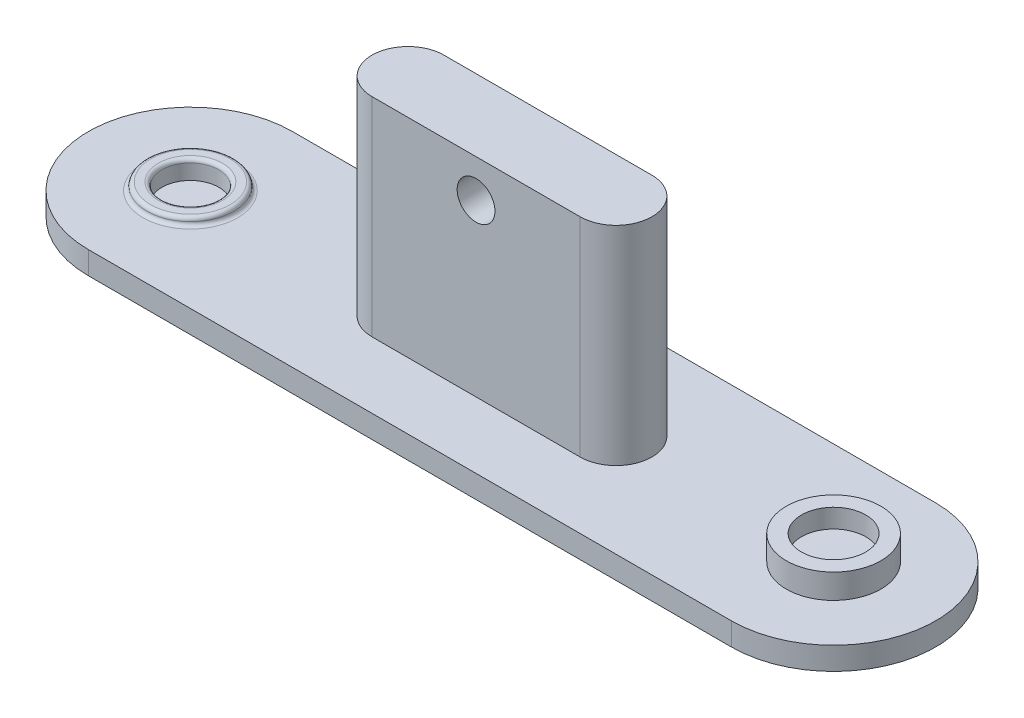
from build123d import *

# Parameters (mm, degrees)
BOSS_EXTRUDE1_DEPTH = 3
SKETCH7_R           = 5.75
BOSS_EXTRUDE5_DEPTH = 1
SKETCH2_R           = 3.75
CUT_EXTRUDE1_DEPTH  = 2.5
SKETCH3_R           = 6.25
BOSS_EXTRUDE3_DEPTH = 3.25
SKETCH4_R           = 4.25
CUT_EXTRUDE2_DEPTH  = 2.5
BOSS_EXTRUDE4_DEPTH = 27.5
SKETCH6_R           = 2.5
CUT_EXTRUDE3_DEPTH  = 67.327313378
FILLET1_R           = 0.5


with BuildPart() as part:
    # Sketch1 → Boss-Extrude1 (new body)
    with BuildSketch(Plane(origin=(0, 0, 0), x_dir=(1, 0, 0), z_dir=(0, 1, 0))):
        with BuildLine():
            Line((-42.5, -13.5), (42.5, -13.5))
            ThreePointArc((42.5, -13.5), (56, 0), (42.5, 13.5))
            Line((42.5, 13.5), (-42.5, 13.5))
            ThreePointArc((-42.5, 13.5), (-56, 0), (-42.5, -13.5))
        make_face()
    extrude(amount=BOSS_EXTRUDE1_DEPTH)

    # Sketch7 → Boss-Extrude5 (add)
    with BuildSketch(Plane(origin=(0, 3, 0), x_dir=(1, 0, 0), z_dir=(0, 1, 0))):
        with Locations(Location((-42.5, 0, 0), (0, 0, 270))):
            Circle(SKETCH7_R)
    extrude(amount=BOSS_EXTRUDE5_DEPTH)

    # Sketch2 → Cut-Extrude1 (cut)
    with BuildSketch(Plane(origin=(0, 4, 0), x_dir=(1, 0, 0), z_dir=(0, 1, 0))):
        with Locations(Location((-42.5, 0, 0), (0, 0, 270))):
            Circle(SKETCH2_R)
    extrude(amount=-CUT_EXTRUDE1_DEPTH, mode=Mode.SUBTRACT)

    # Sketch3 → Boss-Extrude3 (add)
    with BuildSketch(Plane(origin=(0, 3, 0), x_dir=(1, 0, 0), z_dir=(0, 1, 0))):
        with Locations(Location((42.5, 0, 0), (0, 0, 90))):
            Circle(SKETCH3_R)
    extrude(amount=BOSS_EXTRUDE3_DEPTH)

    # Sketch4 → Cut-Extrude2 (cut)
    with BuildSketch(Plane(origin=(0, 6.25, 0), x_dir=(1, 0, 0), z_dir=(0, 1, 0))):
        with Locations(Location((42.5, 0, 0), (0, 0, 270))):
            Circle(SKETCH4_R)
    extrude(amount=-CUT_EXTRUDE2_DEPTH, mode=Mode.SUBTRACT)

    # Sketch5 → Boss-Extrude4 (add)
    with BuildSketch(Plane(origin=(0, 3, 0), x_dir=(1, 0, 0), z_dir=(0, 1, 0))):
        with BuildLine():
            Line((-13.75, 4.75), (13.75, 4.75))
            ThreePointArc((13.75, 4.75), (18.5, 0), (13.75, -4.75))
            Line((13.75, -4.75), (-13.75, -4.75))
            ThreePointArc((-13.75, -4.75), (-18.5, 0), (-13.75, 4.75))
        make_face()
    extrude(amount=BOSS_EXTRUDE4_DEPTH)

    # Sketch6 → Cut-Extrude3 (cut, through all)
    with BuildSketch(Plane(origin=(0, 0, -4.75), x_dir=(-1, 0, 0), z_dir=(0, 0, -1))):
        with Locations((0, 25.5)):
            Circle(SKETCH6_R)
    extrude(amount=-CUT_EXTRUDE3_DEPTH, mode=Mode.SUBTRACT)

    # Fillet1
    fillet1_edges = [part.edges().sort_by_distance(p)[0] for p in [
        (-42.5, 3, -5.75),
        (-42.5, 4, -5.75),
        (-42.5, 4, -3.75),
    ]]
    fillet(fillet1_edges, radius=FILLET1_R - 0.0001)  # a hair under: the kernel refuses the full size


solid = part.part
